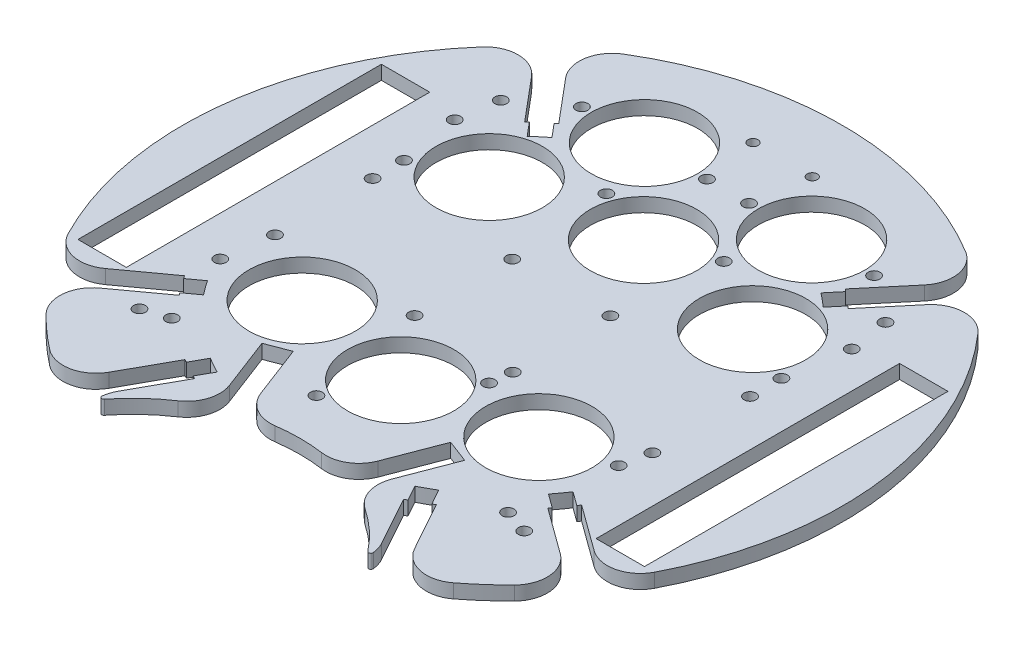
from build123d import *

# Parameters (mm, degrees)
BOSS_EXTRUDE2_OUTLINE_R   = 1.35
BOSS_EXTRUDE2_OUTLINE_W   = 11
BOSS_EXTRUDE2_OUTLINE_H   = 69
BOSS_EXTRUDE2_OUTLINE_R_2 = 12.095
BOSS_EXTRUDE2_OUTLINE_R_3 = 1.143
BOSS_EXTRUDE2_DEPTH       = 3.175
CUT_EXTRUDE1_DEPTH        = 6.35
FILLET1_R                 = 0.5


# Read off the part's stored shape, not the designer's step: Boss-Extrude2
with BuildPart() as part:
    # Boss-Extrude2 outline → Boss-Extrude2 (new body)
    with BuildSketch(Plane(origin=(0, 0, 0), x_dir=(1, 0, 0), z_dir=(0, 1, 0))):
        with BuildLine():
            ThreePointArc((-13.319120077, -43.925216134), (-10.126305957, -47.701325441), (-5.276948898, -48.669209533))
            ThreePointArc((-5.276948898, -48.669209533), (0, -48.302004425), (5.276948898, -48.669209533))
            ThreePointArc((5.276948898, -48.669209533), (10.126305957, -47.701325441), (13.319120077, -43.925216134))
            Line((13.319120077, -43.925216134), (17.904063474, -31.950549264))
            Line((17.904063474, -31.950549264), (23.040433069, -33.917198033))
            Line((23.040433069, -33.917198033), (18.455489673, -45.891864903))
            ThreePointArc((18.455489673, -45.891864903), (18.309924074, -50.834725832), (21.272807595, -54.79381471))
            ThreePointArc((21.272807595, -54.79381471), (26.466137741, -58.99482374), (30.845959646, -64.038266509))
            ThreePointArc((30.845959646, -64.038266509), (30.722917613, -61.793165345), (29.939937248, -59.685427143))
            Line((29.939937248, -59.685427143), (23.761921217, -48.539993511))
            Line((23.761921217, -48.539993511), (28.572329606, -45.873540599))
            Line((28.572329606, -45.873540599), (34.750345491, -57.018976288))
            ThreePointArc((34.750345491, -57.018976288), (39.797694407, -60.728851606), (45.899993549, -59.314337155))
            ThreePointArc((45.899993549, -59.314337155), (49.682691748, -56.183895741), (53.252452412, -52.812652955))
            ThreePointArc((53.252452412, -52.812652955), (55.400241506, -46.895968251), (52.284336639, -41.426846498))
            Line((52.284336639, -41.426846498), (41.919203487, -33.87844485))
            Line((41.919203487, -33.87844485), (45.152040904, -29.428864843))
            Line((45.152040904, -29.428864843), (55.532494673, -36.970706015))
            ThreePointArc((55.532494673, -36.970706015), (61.693781059, -38.244294688), (66.657056834, -34.377852961))
            ThreePointArc((66.657056834, -34.377852961), (74.442262703, 9.129596032), (56.374397975, 49.466425512))
            ThreePointArc((56.374397975, 49.466425512), (50.654117331, 52.01932544), (44.991624855, 49.340690033))
            Line((44.991624855, 49.340690033), (36.78429665, 39.55957716))
            Line((36.78429665, 39.55957716), (32.571052213, 43.094909013))
            Line((32.571052213, 43.094909013), (40.778380417, 52.876021886))
            ThreePointArc((40.778380417, 52.876021886), (42.433039833, 58.917628535), (38.925607882, 64.107698843))
            ThreePointArc((38.925607882, 64.107698843), (0, 75), (-38.925607882, 64.107698843))
            ThreePointArc((-38.925607882, 64.107698843), (-42.433039833, 58.917628535), (-40.778380417, 52.876021886))
            Line((-40.778380417, 52.876021886), (-32.571052213, 43.094909013))
            Line((-32.571052213, 43.094909013), (-36.78429665, 39.55957716))
            Line((-36.78429665, 39.55957716), (-44.991624855, 49.340690033))
            ThreePointArc((-44.991624855, 49.340690033), (-50.654117331, 52.01932544), (-56.374397975, 49.466425512))
            ThreePointArc((-56.374397975, 49.466425512), (-74.442262703, 9.129596032), (-66.657056834, -34.377852961))
            ThreePointArc((-66.657056834, -34.377852961), (-61.693781059, -38.244294688), (-55.532494673, -36.970706015))
            Line((-55.532494673, -36.970706015), (-45.152040904, -29.428864843))
            Line((-45.152040904, -29.428864843), (-41.919203487, -33.87844485))
            Line((-41.919203487, -33.87844485), (-52.284336639, -41.426846498))
            ThreePointArc((-52.284336639, -41.426846498), (-55.400241506, -46.895968251), (-53.252452412, -52.812652955))
            ThreePointArc((-53.252452412, -52.812652955), (-49.682691748, -56.183895741), (-45.899993549, -59.314337155))
            ThreePointArc((-45.899993549, -59.314337155), (-39.797694407, -60.728851606), (-34.750345491, -57.018976288))
            Line((-34.750345491, -57.018976288), (-28.572329606, -45.873540599))
            Line((-28.572329606, -45.873540599), (-23.761921217, -48.539993511))
            Line((-23.761921217, -48.539993511), (-29.939937248, -59.685427143))
            ThreePointArc((-29.939937248, -59.685427143), (-30.722917613, -61.793165345), (-30.845959646, -64.038266509))
            ThreePointArc((-30.845959646, -64.038266509), (-26.466137741, -58.99482374), (-21.272807595, -54.79381471))
            ThreePointArc((-21.272807595, -54.79381471), (-18.309924074, -50.834725832), (-18.455489673, -45.891864903))
            Line((-18.455489673, -45.891864903), (-23.040433069, -33.917198033))
            Line((-23.040433069, -33.917198033), (-17.904063474, -31.950549264))
            Line((-17.904063474, -31.950549264), (-13.319120077, -43.925216134))
        make_face()
        with Locations((-43.735655662, -41.075447944)):
            Circle(BOSS_EXTRUDE2_OUTLINE_R, mode=Mode.SUBTRACT)
        with Locations((-38.234289702, -39.23697625)):
            Circle(BOSS_EXTRUDE2_OUTLINE_R, mode=Mode.SUBTRACT)
        with Locations((-6.55476095, -38.026099982)):
            Circle(BOSS_EXTRUDE2_OUTLINE_R, mode=Mode.SUBTRACT)
        with Locations((-44.385223141, -22.074211772)):
            Circle(BOSS_EXTRUDE2_OUTLINE_R, mode=Mode.SUBTRACT)
        with Locations((-58.910067426, 0.102907352)):
            Rectangle(BOSS_EXTRUDE2_OUTLINE_W, BOSS_EXTRUDE2_OUTLINE_H, mode=Mode.SUBTRACT)
        with Locations((-42.910067426, -11.1)):
            Circle(BOSS_EXTRUDE2_OUTLINE_R, mode=Mode.SUBTRACT)
        with Locations((-26.905821676, -20.904643604)):
            Circle(BOSS_EXTRUDE2_OUTLINE_R_2, mode=Mode.SUBTRACT)
        with Locations((-11.160067426, -11.1)):
            Circle(BOSS_EXTRUDE2_OUTLINE_R, mode=Mode.SUBTRACT)
        with Locations((38.234289702, -39.23697625)):
            Circle(BOSS_EXTRUDE2_OUTLINE_R, mode=Mode.SUBTRACT)
        with Locations((43.735655662, -41.075447944)):
            Circle(BOSS_EXTRUDE2_OUTLINE_R, mode=Mode.SUBTRACT)
        with Locations((0, -25.409190322)):
            Circle(BOSS_EXTRUDE2_OUTLINE_R_2, mode=Mode.SUBTRACT)
        with Locations((10.597026674, -15.930038136)):
            Circle(BOSS_EXTRUDE2_OUTLINE_R, mode=Mode.SUBTRACT)
        with Locations((26.905821676, -20.904643604)):
            Circle(BOSS_EXTRUDE2_OUTLINE_R_2, mode=Mode.SUBTRACT)
        with Locations((11.160067426, -11.1)):
            Circle(BOSS_EXTRUDE2_OUTLINE_R, mode=Mode.SUBTRACT)
        with Locations((41.601681906, -17.457756634)):
            Circle(BOSS_EXTRUDE2_OUTLINE_R, mode=Mode.SUBTRACT)
        with Locations((42.910067426, -11.1)):
            Circle(BOSS_EXTRUDE2_OUTLINE_R, mode=Mode.SUBTRACT)
        with Locations((58.910067426, 0.102907352)):
            Rectangle(BOSS_EXTRUDE2_OUTLINE_W, BOSS_EXTRUDE2_OUTLINE_H, mode=Mode.SUBTRACT)
        with Locations((-42.910067426, 11.1)):
            Circle(BOSS_EXTRUDE2_OUTLINE_R, mode=Mode.SUBTRACT)
        with Locations((-42.910067426, 18.234848025)):
            Circle(BOSS_EXTRUDE2_OUTLINE_R, mode=Mode.SUBTRACT)
        with Locations((-45.13872464, 31.997163897)):
            Circle(BOSS_EXTRUDE2_OUTLINE_R, mode=Mode.SUBTRACT)
        with Locations((-11.160067426, 11.1)):
            Circle(BOSS_EXTRUDE2_OUTLINE_R, mode=Mode.SUBTRACT)
        with Locations((-29.939937248, 24.651901309)):
            Circle(BOSS_EXTRUDE2_OUTLINE_R_2, mode=Mode.SUBTRACT)
        with Locations((-13.346873881, 34.693819966)):
            Circle(BOSS_EXTRUDE2_OUTLINE_R, mode=Mode.SUBTRACT)
        with Locations((-43.735655662, 41.075447944)):
            Circle(BOSS_EXTRUDE2_OUTLINE_R, mode=Mode.SUBTRACT)
        with Locations((-33.21799214, 49)):
            Circle(BOSS_EXTRUDE2_OUTLINE_R, mode=Mode.SUBTRACT)
        with Locations((-19, 49)):
            Circle(BOSS_EXTRUDE2_OUTLINE_R_2, mode=Mode.SUBTRACT)
        with Locations((-4.78200786, 49)):
            Circle(BOSS_EXTRUDE2_OUTLINE_R, mode=Mode.SUBTRACT)
        with Locations((-6.731, 61.422565207)):
            Circle(BOSS_EXTRUDE2_OUTLINE_R_3, mode=Mode.SUBTRACT)
        with Locations((11.160067426, 11.1)):
            Circle(BOSS_EXTRUDE2_OUTLINE_R, mode=Mode.SUBTRACT)
        with Locations((0, 29.793589551)):
            Circle(BOSS_EXTRUDE2_OUTLINE_R_2, mode=Mode.SUBTRACT)
        with Locations((13.346873881, 34.693819966)):
            Circle(BOSS_EXTRUDE2_OUTLINE_R, mode=Mode.SUBTRACT)
        with Locations((29.939937248, 24.651901309)):
            Circle(BOSS_EXTRUDE2_OUTLINE_R_2, mode=Mode.SUBTRACT)
        with Locations((42.910067426, 11.1)):
            Circle(BOSS_EXTRUDE2_OUTLINE_R, mode=Mode.SUBTRACT)
        with Locations((42.910067426, 18.234848025)):
            Circle(BOSS_EXTRUDE2_OUTLINE_R, mode=Mode.SUBTRACT)
        with Locations((45.13872464, 31.997163897)):
            Circle(BOSS_EXTRUDE2_OUTLINE_R, mode=Mode.SUBTRACT)
        with Locations((4.78200786, 49)):
            Circle(BOSS_EXTRUDE2_OUTLINE_R, mode=Mode.SUBTRACT)
        with Locations((19, 49)):
            Circle(BOSS_EXTRUDE2_OUTLINE_R_2, mode=Mode.SUBTRACT)
        with Locations((33.21799214, 49)):
            Circle(BOSS_EXTRUDE2_OUTLINE_R, mode=Mode.SUBTRACT)
        with Locations((6.731, 61.422565207)):
            Circle(BOSS_EXTRUDE2_OUTLINE_R_3, mode=Mode.SUBTRACT)
        with Locations((43.735655662, 41.075447944)):
            Circle(BOSS_EXTRUDE2_OUTLINE_R, mode=Mode.SUBTRACT)
    extrude(amount=BOSS_EXTRUDE2_DEPTH)

    # Sketch3 → Cut-Extrude1 (cut)
    with BuildSketch(Plane(origin=(0, 3.175, 0), x_dir=(1, 0, 0), z_dir=(0, 1, 0))):
        with BuildLine():
            Line((-30.581569801, 39.557143331), (-34.365473638, 44.066624323))
            ThreePointArc((-34.365473638, 44.066624323), (-35.920574868, 42.808474147), (-37.42965141, 41.495473884))
            Line((-37.42965141, 41.495473884), (-33.645747573, 36.985992892))
            ThreePointArc((-33.645747573, 36.985992892), (-32.139380484, 38.302222156), (-30.581569801, 39.557143331))
        make_face()
        with BuildLine():
            Line((-41.563047759, -27.79411918), (-46.321630401, -31.259553973))
            ThreePointArc((-46.321630401, -31.259553973), (-45.173194515, -32.897350272), (-43.966878649, -34.492995513))
            Line((-43.966878649, -34.492995513), (-39.208296007, -31.02756072))
            ThreePointArc((-39.208296007, -31.02756072), (-40.418019242, -29.434396894), (-41.563047759, -27.79411918))
        make_face()
        with BuildLine():
            Line((-22.47184145, -44.665605804), (-25.325774778, -49.814237819))
            ThreePointArc((-25.325774778, -49.814237819), (-27.09237079, -48.875930708), (-28.824253607, -47.874999338))
            Line((-28.824253607, -47.874999338), (-25.970320279, -42.726367323))
            ThreePointArc((-25.970320279, -42.726367323), (-24.240481012, -43.730985357), (-22.47184145, -44.665605804))
        make_face()
        with BuildLine():
            Line((25.970320279, -42.726367323), (28.824253607, -47.874999338))
            ThreePointArc((28.824253607, -47.874999338), (27.09237079, -48.875930708), (25.325774778, -49.814237819))
            Line((25.325774778, -49.814237819), (22.47184145, -44.665605804))
            ThreePointArc((22.47184145, -44.665605804), (24.240481012, -43.730985357), (25.970320279, -42.726367323))
        make_face()
        with BuildLine():
            Line((39.208296007, -31.02756072), (43.966878649, -34.492995513))
            ThreePointArc((43.966878649, -34.492995513), (45.173194515, -32.897350272), (46.321630401, -31.259553973))
            Line((46.321630401, -31.259553973), (41.563047759, -27.79411918))
            ThreePointArc((41.563047759, -27.79411918), (40.418019242, -29.434396894), (39.208296007, -31.02756072))
        make_face()
        with BuildLine():
            Line((33.645747573, 36.985992892), (37.42965141, 41.495473884))
            ThreePointArc((37.42965141, 41.495473884), (35.920574868, 42.808474147), (34.365473638, 44.066624323))
            Line((34.365473638, 44.066624323), (30.581569801, 39.557143331))
            ThreePointArc((30.581569801, 39.557143331), (32.139380484, 38.302222156), (33.645747573, 36.985992892))
        make_face()
    extrude(amount=-CUT_EXTRUDE1_DEPTH, mode=Mode.SUBTRACT)

    # Fillet1
    fillet1_edges = [part.edges().sort_by_distance(p)[0] for p in [
        (-30.845959646, 1.5875, 64.038266509),
        (30.845959646, 1.5875, 64.038266509),
    ]]
    fillet(fillet1_edges, radius=FILLET1_R)


solid = part.part
